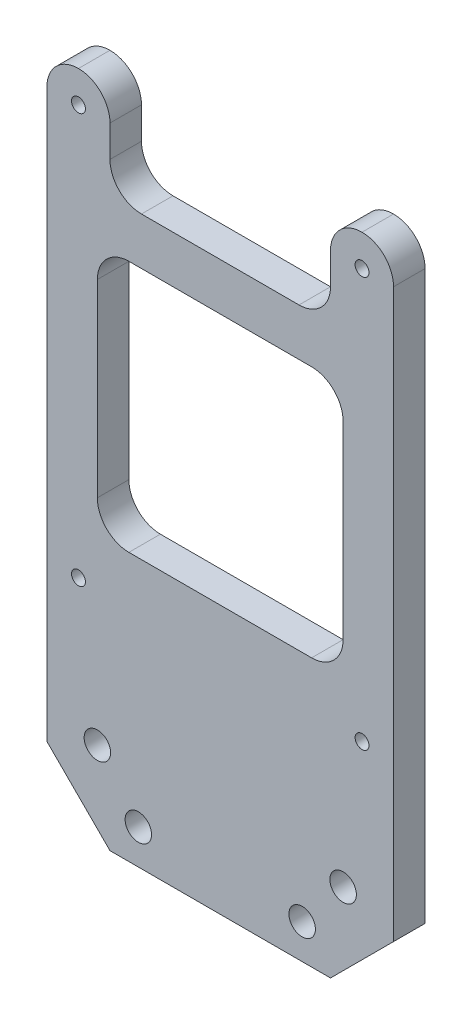
from build123d import *

# Parameters (mm, degrees)
SKETCH_1_W          = 55
SKETCH_1_H          = 105
SKETCH_1_R          = 1.1
EXTRUDE_1_DEPTH     = 5
CHAMFER_1_SIZE      = 10
SKETCH_4_R          = 2.1
CUT_EXTRUDE_1_DEPTH = 10
SKETCH_5_W          = 35
SKETCH_5_H          = 15
CUT_EXTRUDE_2_DEPTH = 10
SKETCH_6_W          = 39
SKETCH_6_H          = 40
CUT_EXTRUDE_3_DEPTH = 10
FILLET_3_R          = 5
FILLET_4_R          = 5


with BuildPart() as part:
    # 草图1 → 凸台-拉伸1 (new body)
    with BuildSketch(Plane.XY):
        Rectangle(SKETCH_1_W, SKETCH_1_H)
        with Locations((-22.5, 47.5)):
            Circle(SKETCH_1_R, mode=Mode.SUBTRACT)
        with Locations(Location((22.5, 47.5, 0), (0, 0, 180))):
            Circle(SKETCH_1_R, mode=Mode.SUBTRACT)
        with Locations((-22.5, -17.5)):
            Circle(SKETCH_1_R, mode=Mode.SUBTRACT)
        with Locations(Location((22.5, -17.5, 0), (0, 0, 180))):
            Circle(SKETCH_1_R, mode=Mode.SUBTRACT)
    extrude(amount=EXTRUDE_1_DEPTH)

    # 倒角1
    chamfer_1_edges = [part.edges().sort_by_distance(p)[0] for p in [
        (27.5, -52.5, 2.5),
        (-27.5, -52.5, 2.5),
    ]]
    chamfer(chamfer_1_edges, length=CHAMFER_1_SIZE)

    # 草图4 → 切除-拉伸1 (cut)
    with BuildSketch(Plane(origin=(0, 0, 0), x_dir=(-1, 0, 0), z_dir=(0, 0, -1))):
        with Locations((-13, -47)):
            Circle(SKETCH_4_R)
        with Locations((-19.5, -39)):
            Circle(SKETCH_4_R)
        with Locations(Location((19.5, -39, 0), (0, 0, 180))):
            Circle(SKETCH_4_R)
        with Locations(Location((13, -47, 0), (0, 0, 180))):
            Circle(SKETCH_4_R)
    extrude(amount=-CUT_EXTRUDE_1_DEPTH, mode=Mode.SUBTRACT)

    # 草图5 → 切除-拉伸2 (cut)
    with BuildSketch(Plane.XY.offset(5)):
        with Locations((0, 45)):
            Rectangle(SKETCH_5_W, SKETCH_5_H)
    extrude(amount=-CUT_EXTRUDE_2_DEPTH, mode=Mode.SUBTRACT)

    # 草图6 → 切除-拉伸3 (cut)
    with BuildSketch(Plane.XY.offset(5)):
        with Locations((0, 10)):
            Rectangle(SKETCH_6_W, SKETCH_6_H)
    extrude(amount=-CUT_EXTRUDE_3_DEPTH, mode=Mode.SUBTRACT)

    # 圆角3
    fillet_3_edges = [part.edges().sort_by_distance(p)[0] for p in [
        (19.5, 30, 2.5),
        (19.5, -10, 2.5),
        (-19.5, -10, 2.5),
        (-19.5, 30, 2.5),
    ]]
    fillet(fillet_3_edges, radius=FILLET_3_R)

    # 圆角4
    fillet_4_edges = [part.edges().sort_by_distance(p)[0] for p in [
        (17.5, 52.5, 2.5),
        (27.5, 52.5, 2.5),
        (-27.5, 52.5, 2.5),
        (-17.5, 52.5, 2.5),
        (17.5, 37.5, 2.5),
        (-17.5, 37.5, 2.5),
    ]]
    fillet(fillet_4_edges, radius=FILLET_4_R - 0.0001)  # a hair under: the kernel refuses the full size


solid = part.part
